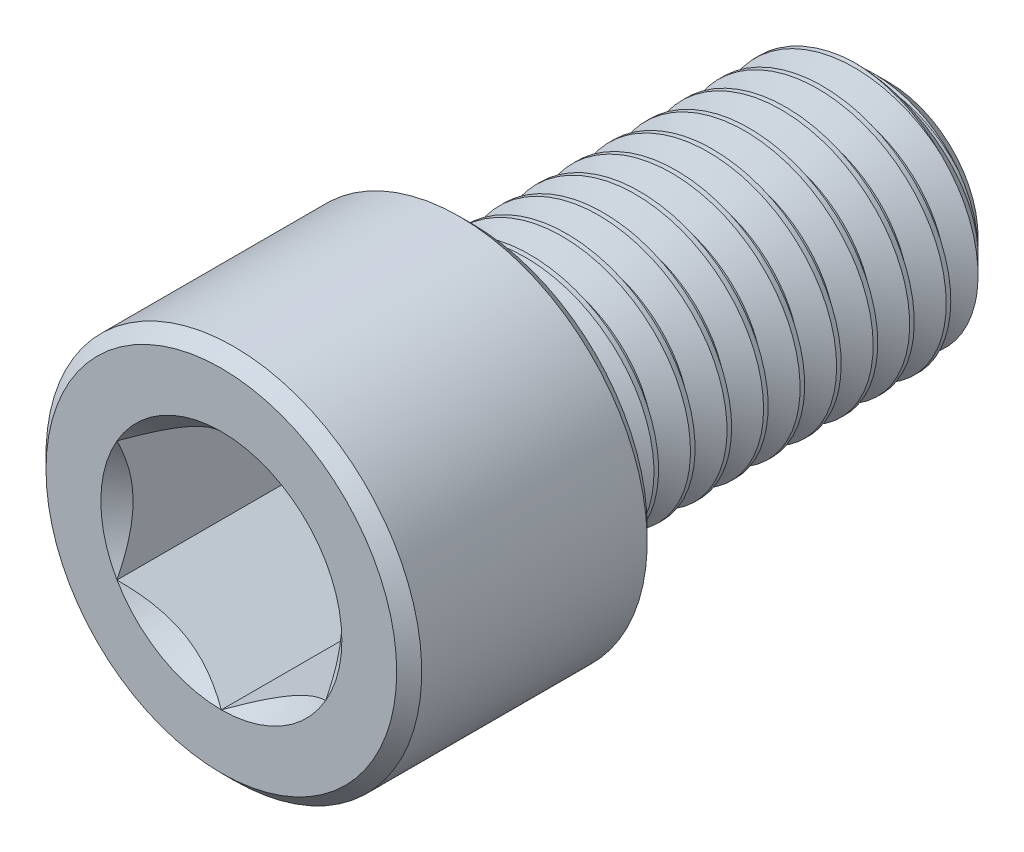
from build123d import *

# Parameters (mm, degrees)
CUT_EXTRUDE1_DEPTH = 11
CUT_SWEEP1_PITCH   = 1.75
CUT_SWEEP1_TO      = 20


with BuildPart() as part:
    # Sketch2 → Revolve1 (revolve)
    with BuildSketch(Plane(origin=(0, 0, 0), x_dir=(0, 0, -1), z_dir=(1, 0, 0))):
        Polygon((-16, 0), (-16, 8.4), (-15.4, 9), (-4.6, 9), (-4, 8.4), (-4, 6), (14.25, 6), (16, 4.25), (16, 0), align=None)
    revolve(axis=Axis((0, 0, -16), (0, 0, 1)))

    # Sketch3 → Cut-Extrude1 (cut)
    with BuildSketch(Plane.XY.offset(16)):
        Polygon((5, -2.886751346), (5, 2.886751346), (0, 5.773502692), (-5, 2.886751346), (-5, -2.886751346), (0, -5.773502692), align=None)
    extrude(amount=-CUT_EXTRUDE1_DEPTH, mode=Mode.SUBTRACT)

    # Cut-Extrude2 cone 1 section (through the dimple's axis) → Cut-Extrude2 (revolve, cut)
    with BuildSketch(Plane(origin=(0, 0, 16), x_dir=(0, -1, 0), z_dir=(1, 0, 0))):
        Polygon((0, 0), (5.773502692, 0), (0, 5.773502692), align=None)
    revolve(axis=Axis((0, 0, 16), (0, 0, -1)), mode=Mode.SUBTRACT)


with BuildPart() as body_2:
    # Split1: read off the stored shape, not the designer's step
    # Split1: the piece on the far side of the plane
    add(part.part)
    split(bisect_by=Plane.XY.offset(4), keep=Keep.BOTTOM)

    # Cut-Sweep1: arcs per turn and ends read off the stored shape
    # Cut-Sweep1: the profile of Sketch7 screwed along a right-hand helix through 12.578571 turns, 10 arcs to a turn; built about Z, then put on its axis
    cut_sweep1_z = Axis((0, 0, 0), (0, 0, 1))
    cut_sweep1_corners = [(6.094721529, 0, 0.0546875), (6.094721529, 0, -1.5859375), (4.863341658, 0, -0.875), (4.863341658, 0, -0.65625)]
    with BuildLine(mode=Mode.PRIVATE) as cut_sweep1_profile:
        Line(cut_sweep1_corners[0], cut_sweep1_corners[1])
        Line(cut_sweep1_corners[1], cut_sweep1_corners[2])
        Line(cut_sweep1_corners[2], cut_sweep1_corners[3])
        Line(cut_sweep1_corners[3], cut_sweep1_corners[0])
    cut_sweep1_cap = Face(cut_sweep1_profile.wire())
    cut_sweep1_turn_angles = [0, 18, 36, 54, 72, 90, 108, 126, 144, 162, 180, 198, 216, 234, 252, 270, 288, 306, 324, 342, 360]
    cut_sweep1_turn_weights = [1, 0.9510565162951535, 1, 0.9510565162951535, 1, 0.9510565162951535, 1, 0.9510565162951535, 1, 0.9510565162951535, 1, 0.9510565162951535, 1, 0.9510565162951535, 1, 0.9510565162951535, 1, 0.9510565162951535, 1, 0.9510565162951535, 1]
    cut_sweep1_turn_rails = [Edge.make_bspline([Vector(p[0], p[1], 0).rotate(cut_sweep1_z, cut_sweep1_turn_angles[k]) / cut_sweep1_turn_weights[k] + Vector(0, 0, p[2] + CUT_SWEEP1_PITCH * cut_sweep1_turn_angles[k] / 360) for k in range(21)], [0, 0, 0, 1, 1, 2, 2, 3, 3, 4, 4, 5, 5, 6, 6, 7, 7, 8, 8, 9, 9, 10, 10, 10], 2, cut_sweep1_turn_weights) for p in cut_sweep1_corners]
    cut_sweep1_turn_sides = [Face.make_surface_from_curves(cut_sweep1_turn_rails[p[0]], cut_sweep1_turn_rails[p[1]]) for p in [(0, 1), (1, 2), (2, 3), (3, 0)]]
    cut_sweep1_last_angles = [4320, 4338, 4356, 4374, 4392, 4410, 4428, 4446, 4464, 4482, 4500, 4514.142857143, 4528.285714286]
    cut_sweep1_last_weights = [1, 0.9510565162951535, 1, 0.9510565162951535, 1, 0.9510565162951535, 1, 0.9510565162951535, 1, 0.9510565162951535, 1, 0.9696895203766667, 1]
    cut_sweep1_last_rails = [Edge.make_bspline([Vector(p[0], p[1], 0).rotate(cut_sweep1_z, cut_sweep1_last_angles[k]) / cut_sweep1_last_weights[k] + Vector(0, 0, p[2] + CUT_SWEEP1_PITCH * cut_sweep1_last_angles[k] / 360) for k in range(13)], [0, 0, 0, 1, 1, 2, 2, 3, 3, 4, 4, 5, 5, 6, 6, 6], 2, cut_sweep1_last_weights) for p in cut_sweep1_corners]
    cut_sweep1_last_sides = [Face.make_surface_from_curves(cut_sweep1_last_rails[p[0]], cut_sweep1_last_rails[p[1]]) for p in [(0, 1), (1, 2), (2, 3), (3, 0)]]
    cut_sweep1 = Plane(origin=(0, 0, -16), x_dir=(0, 1, 0), z_dir=(0, 0, 1)) * split(Solid(Shell([*[p.moved(Location((0, 0, CUT_SWEEP1_PITCH * i))) for i in range(12) for p in cut_sweep1_turn_sides], *cut_sweep1_last_sides, cut_sweep1_cap, cut_sweep1_cap.rotate(cut_sweep1_z, 4528.285714286).moved(Location((0, 0, CUT_SWEEP1_PITCH * 4528.285714286 / 360)))])), bisect_by=Plane.XY.offset(CUT_SWEEP1_TO), keep=Keep.BOTTOM, mode=Mode.PRIVATE)
    add(cut_sweep1, mode=Mode.SUBTRACT)


with BuildPart() as part_1:
    add(part.part)

    # Split1
    split(bisect_by=Plane.XY.offset(4), keep=Keep.TOP)

    add(body_2.part)  # Boss-Extrude1 merges body 2
    # Boss-Extrude1: read off the stored shape, not the designer's step
    # Boss-Extrude1 outline → Boss-Extrude1 (revolve)
    with BuildSketch(Plane.XZ):
        Polygon((4.863339899, 4), (4.863339899, 2.863339899), (6, 4), align=None)
    revolve(axis=Axis((0, 0, 0), (0, 0, 1)))


solid = part_1.part
